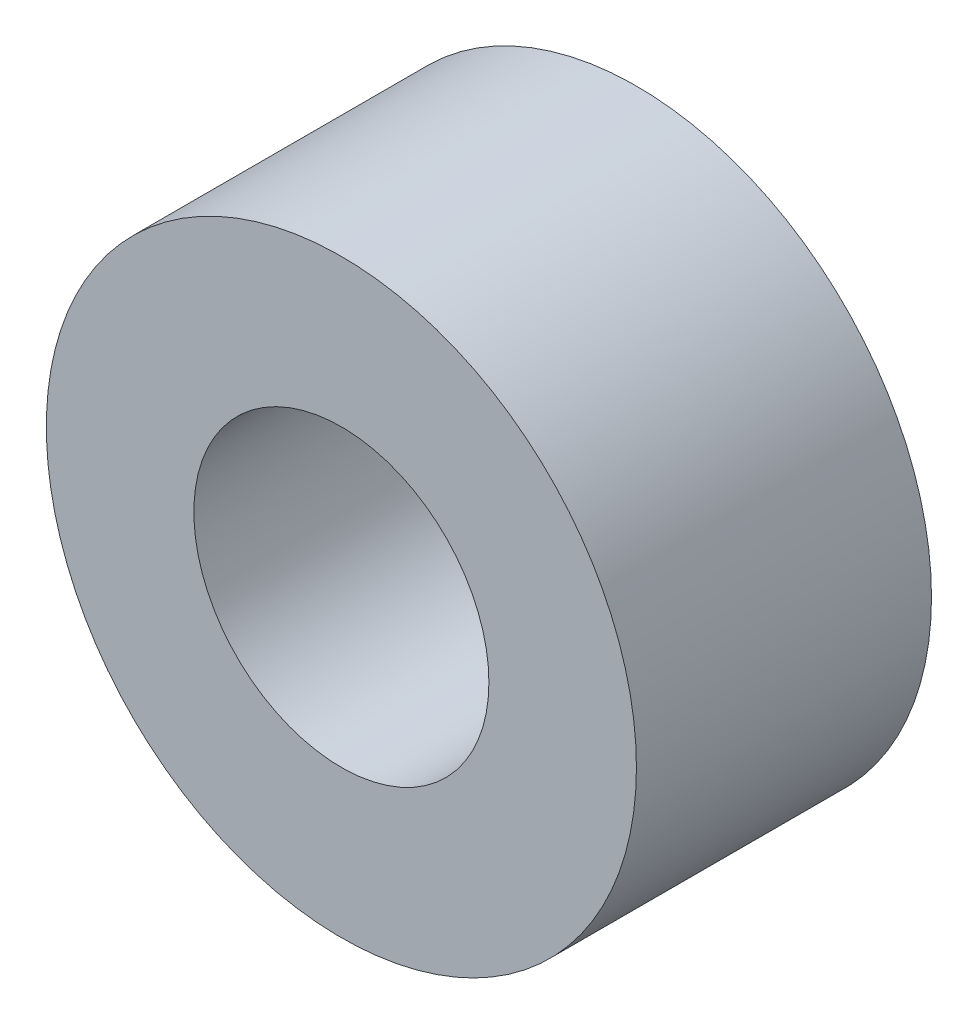
from build123d import *

# Parameters (mm, degrees)
CROQUIS1_R              = 5
CROQUIS1_R_2            = 2.5
SALIENTE_EXTRUIR1_DEPTH = 5


with BuildPart() as part:
    # Croquis1 → Saliente-Extruir1 (new body)
    with BuildSketch(Plane.XY):
        with Locations((54.9, 15.2)):
            Circle(CROQUIS1_R)
        with Locations((54.9, 15.2)):
            Circle(CROQUIS1_R_2, mode=Mode.SUBTRACT)
    extrude(amount=SALIENTE_EXTRUIR1_DEPTH)


solid = part.part
